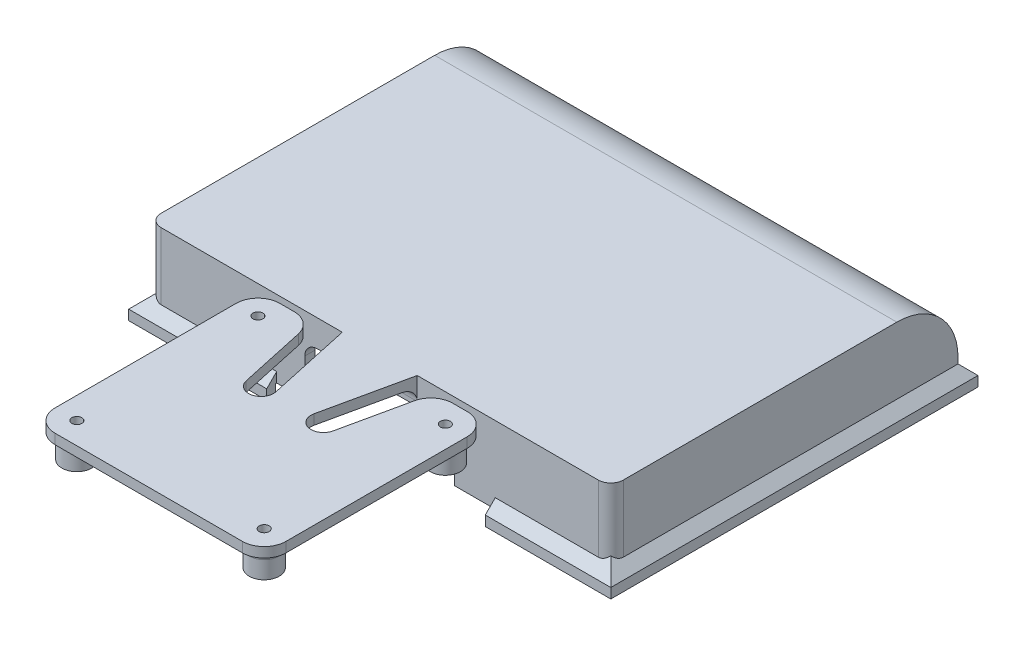
from build123d import *

# Parameters (mm, degrees)
BODY_DEPTH                       = 70.053212
BODY_DEPTH_BACK                  = 3.946788
SHELL1_T                         = -1.6
SKETCH7_W                        = 74
SKETCH7_H                        = 1.6
BACK_WALL_DEPTH                  = 12.3
SKETCH8_W                        = 37
SKETCH8_H                        = 1.6
FAN_MOUNT_DEPTH                  = 37
SKETCH12_R                       = 2.4
FAN_BOSS_DEPTH                   = 3.8
FILLET3_R                        = 1
TAP_DRILL_FOR_M2_TAP1_AT_2_COUNT = 2
TAP_DRILL_FOR_M2_TAP1_AT_2_PITCH = 29
TAP_DRILL_FOR_M2_TAP1_AT_3_COUNT = 2
TAP_DRILL_FOR_M2_TAP1_AT_3_PITCH = 41.72529209
TAP_DRILL_FOR_M2_TAP1_AT_4_COUNT = 2
TAP_DRILL_FOR_M2_TAP1_AT_4_PITCH = 30
CUT_EXTRUDE1_DEPTH               = 361.928196612
FILLET4_R                        = 3.5
EDGE_START                       = -2
EDGE_FLANGE_OUTLINE_W            = 77.2
EDGE_FLANGE_OUTLINE_H            = 58.8
EDGE_FLANGE_OUTLINE_W_2          = 74
EDGE_FLANGE_OUTLINE_H_2          = 55.6
EDGE_FLANGE_DEPTH                = 3.6
CHAMFER1_SIZE                    = 2
SKETCH18_W                       = 74.39999908
SKETCH18_H                       = 56
BOX_RECESS_DEPTH                 = 1.6
FAN_OPENING_REACH                = 94.012
SKETCH15_W                       = 24
SKETCH15_H                       = 8
SKETCH19_W                       = 35
SKETCH19_H                       = 3.2
FAN_RELIEF_DEPTH                 = 93.012212353
AIR_CHANNEL_REACH                = 363.293
SKETCH20_W                       = 6
SKETCH20_H                       = 3.2
CLIP_RELIEF_DEPTH                = 1.8
LPATTERN2_COUNT                  = 3
LPATTERN2_PITCH                  = 21.6
FILLET1_R                        = 2
FILLET2_R                        = 2


# Read off the part's stored shape, not the designer's step: edge flange
with BuildPart() as part:
    # Sketch1 → body (new, two sides: drawn at the far end of the back side and taken through both)
    with BuildSketch(Plane(origin=(0, 0, 0), x_dir=(0, 0, -1), z_dir=(1, 0, 0)).offset(-BODY_DEPTH_BACK)):
        with BuildLine():
            Line((-316.902840602, -4.539561402), (-261.302840602, -4.539561402))
            Line((-261.302840602, -4.539561402), (-261.302840602, -2.039561402))
            ThreePointArc((-261.302840602, -2.039561402), (-264.173194146, 4.890085054), (-271.102840602, 7.760438598))
            Line((-271.102840602, 7.760438598), (-316.902840602, 7.760438598))
            Line((-316.902840602, 7.760438598), (-316.902840602, -4.539561402))
        make_face()
    extrude(amount=BODY_DEPTH + BODY_DEPTH_BACK)

    # Shell1
    shell1_openings = [part.faces().sort_by_distance(p)[0] for p in [
        (33.053212, -4.539561402, 289.102840602),
        (33.053212, 1.610438598, 316.902840602),
    ]]
    offset(amount=SHELL1_T, openings=shell1_openings, kind=Kind.INTERSECTION)

    # Sketch7 → back wall (add)
    with BuildSketch(Plane(origin=(0, -4.539561402, 0), x_dir=(1, 0, 0), z_dir=(0, 1, 0))):
        with Locations((33.053212174, -316.102840602)):
            Rectangle(SKETCH7_W, SKETCH7_H)
    extrude(amount=BACK_WALL_DEPTH)

    # Sketch8 → fan mount (add)
    with BuildSketch(Plane(origin=(0, 0, 316.902840602), x_dir=(-1, 0, 0), z_dir=(0, 0, -1))):
        with Locations((-33.053212174, 6.960438598)):
            Rectangle(SKETCH8_W, SKETCH8_H)
    extrude(amount=-FAN_MOUNT_DEPTH)

    # Sketch12 → fan boss (add)
    with BuildSketch(Plane.XZ.offset(-6.160438598)):
        with Locations(Location((18.053212174, 350.402840602, 0), (0, 0, 180))):
            Circle(SKETCH12_R)
        with Locations(Location((18.053212174, 321.402840602, 0), (0, 0, 180))):
            Circle(SKETCH12_R)
        with Locations(Location((48.053212174, 350.402840602, 0), (0, 0, 180))):
            Circle(SKETCH12_R)
        with Locations(Location((48.053212174, 321.402840602, 0), (0, 0, 180))):
            Circle(SKETCH12_R)
    extrude(amount=FAN_BOSS_DEPTH)

    # Fillet3
    fillet3_edges = [part.edges().sort_by_distance(p)[0] for p in [
        (20.453212174, 6.160438598, 350.402840602),
        (20.453212174, 6.160438598, 321.402840602),
        (50.453212174, 6.160438598, 350.402840602),
        (50.453212174, 6.160438598, 321.402840602),
    ]]
    fillet(fillet3_edges, radius=FILLET3_R)

    # Sketch14 → Tap Drill for M2 Tap1 (revolve, cut)
    with BuildSketch(Plane(origin=(18.053212174, 2.360438598, 321.402840602), x_dir=(0, 0, -1), z_dir=(1, 0, 0))):
        Polygon((0, 0), (0, 5.4), (0.8, 5.4), (0.8, 2.59634927), (1.05, 0), align=None)
    tap_drill_for_m2_tap1 = revolve(axis=Axis((18.053212174, -3.989561402, 321.402840602), (0, 1, 0)), mode=Mode.SUBTRACT)

    # Tap Drill for M2 Tap1 at 2: Tap Drill for M2 Tap1 ×2
    with Locations(*[(0, 0, i * TAP_DRILL_FOR_M2_TAP1_AT_2_PITCH) for i in range(1, TAP_DRILL_FOR_M2_TAP1_AT_2_COUNT)]):
        add(tap_drill_for_m2_tap1, mode=Mode.SUBTRACT)

    # Tap Drill for M2 Tap1 at 3: Tap Drill for M2 Tap1 ×2
    with Locations(*[Vector(0.7189883760491119, 0, 0.6950220968474748) * (i * TAP_DRILL_FOR_M2_TAP1_AT_3_PITCH) for i in range(1, TAP_DRILL_FOR_M2_TAP1_AT_3_COUNT)]):
        add(tap_drill_for_m2_tap1, mode=Mode.SUBTRACT)

    # Tap Drill for M2 Tap1 at 4: Tap Drill for M2 Tap1 ×2
    with Locations(*[(i * TAP_DRILL_FOR_M2_TAP1_AT_4_PITCH, 0, 0) for i in range(1, TAP_DRILL_FOR_M2_TAP1_AT_4_COUNT)]):
        add(tap_drill_for_m2_tap1, mode=Mode.SUBTRACT)

    # Sketch21 → Cut-Extrude1 (cut, through all)
    with BuildSketch(Plane.XZ.offset(-6.160438598)):
        with BuildLine():
            Line((51.553212174, 317.902840602), (51.553212174, 316.902840602))
            Line((51.553212174, 316.902840602), (39.053212174, 316.902840602))
            Line((39.053212174, 316.902840602), (36.098956176, 330.477536602))
            ThreePointArc((36.098956176, 330.477536602), (37.627908175, 332.8570966), (40.007468173, 331.328144602))
            Line((40.007468173, 331.328144602), (42.929212046, 317.902840602))
            Line((42.929212046, 317.902840602), (51.553212174, 317.902840602))
        make_face()
        with BuildLine():
            Line((27.053212174, 316.902840602), (30.007468173, 330.477536602))
            ThreePointArc((30.007468173, 330.477536602), (28.478516174, 332.8570966), (26.098956176, 331.328144602))
            Line((26.098956176, 331.328144602), (23.177212302, 317.902840602))
            Line((23.177212302, 317.902840602), (14.553212174, 317.902840602))
            Line((14.553212174, 317.902840602), (14.553212174, 316.902840602))
            Line((14.553212174, 316.902840602), (27.053212174, 316.902840602))
        make_face()
    extrude(amount=-CUT_EXTRUDE1_DEPTH, mode=Mode.SUBTRACT)

    # Fillet4
    fillet4_edges = [part.edges().sort_by_distance(p)[0] for p in [
        (42.929212046, 6.960438598, 317.902840602),
        (51.553212174, 6.960438598, 317.902840602),
        (14.553212174, 6.960438598, 317.902840602),
        (23.177212302, 6.960438598, 317.902840602),
        (14.553212174, 6.960438598, 353.902840602),
        (51.553212174, 6.960438598, 353.902840602),
    ]]
    fillet(fillet4_edges, radius=FILLET4_R)

    # edge flange outline → edge flange (add)
    with BuildSketch(Plane.XZ.offset(4.539561402).offset(EDGE_START)):
        with Locations((33.053212174, 289.102840602)):
            Rectangle(EDGE_FLANGE_OUTLINE_W, EDGE_FLANGE_OUTLINE_H)
        with Locations((33.053212174, 289.102840602)):
            Rectangle(EDGE_FLANGE_OUTLINE_W_2, EDGE_FLANGE_OUTLINE_H_2, mode=Mode.SUBTRACT)
    extrude(amount=EDGE_FLANGE_DEPTH)

    # Chamfer1
    # the kernel refuses this chamfer: 2 mm, written as the material it takes off along each edge
    with BuildSketch(Plane(origin=(76.79657815, -2.539561402, 318.502840602), x_dir=(0, 0.027495876610586605, -0.9996219169112968), z_dir=(-1, 0, 0))) as chamfer1_piece_1_section:
        Polygon((CHAMFER1_SIZE * 0.999621916911, CHAMFER1_SIZE * 0.0274958766106), (-CHAMFER1_SIZE * 0.0274958766106, CHAMFER1_SIZE * 0.999621916911), (0, 0), align=None)
    chamfer1_piece_1 = extrude(amount=87.486731952, mode=Mode.PRIVATE)
    chamfer1_piece_1 = split(chamfer1_piece_1, bisect_by=Plane(origin=(73.424895075, -2.62002514, 316.902840602), z_dir=(0, 0, -1)), keep=Keep.TOP, mode=Mode.PRIVATE)
    chamfer1_piece_1 = split(chamfer1_piece_1, bisect_by=Plane(origin=(70.053212, -2.62002514, 316.738821544), z_dir=(1, 0, 0)), keep=Keep.TOP, mode=Mode.PRIVATE)
    add(chamfer1_piece_1, mode=Mode.SUBTRACT)
    with BuildSketch(Plane(origin=(76.79657815, -2.539561402, 318.502840602), x_dir=(0, 0.027495876610586605, -0.9996219169112968), z_dir=(-1, 0, 0))) as chamfer1_piece_2_section:
        Polygon((CHAMFER1_SIZE * 0.999621916911, CHAMFER1_SIZE * 0.0274958766106), (-CHAMFER1_SIZE * 0.0274958766106, CHAMFER1_SIZE * 0.999621916911), (0, 0), align=None)
    chamfer1_piece_2 = extrude(amount=87.486731952, mode=Mode.PRIVATE)
    chamfer1_piece_2 = split(chamfer1_piece_2, bisect_by=Plane(origin=(73.424895075, -3.230998227, 316.902840602), z_dir=(0, 0, 1)), keep=Keep.TOP, mode=Mode.PRIVATE)
    chamfer1_piece_2 = split(chamfer1_piece_2, bisect_by=Plane(origin=(70.053212, -3.230998227, 317.903992859), z_dir=(1, 0, 0)), keep=Keep.TOP, mode=Mode.PRIVATE)
    add(chamfer1_piece_2, mode=Mode.SUBTRACT)
    with BuildSketch(Plane(origin=(76.79657815, -2.539561402, 318.502840602), x_dir=(0, 0.027495876610586605, -0.9996219169112968), z_dir=(-1, 0, 0))) as chamfer1_piece_3_section:
        Polygon((CHAMFER1_SIZE * 0.999621916911, CHAMFER1_SIZE * 0.0274958766106), (-CHAMFER1_SIZE * 0.0274958766106, CHAMFER1_SIZE * 0.999621916911), (0, 0), align=None)
    chamfer1_piece_3 = extrude(amount=87.486731952, mode=Mode.PRIVATE)
    chamfer1_piece_3 = split(chamfer1_piece_3, bisect_by=Plane(origin=(33.053212, -3.230998227, 316.902840602), z_dir=(0, 0, 1)), keep=Keep.TOP, mode=Mode.PRIVATE)
    chamfer1_piece_3 = split(chamfer1_piece_3, bisect_by=Plane(origin=(70.053212, -3.230998227, 317.903992859), z_dir=(-1, 0, 0)), keep=Keep.TOP, mode=Mode.PRIVATE)
    chamfer1_piece_3 = split(chamfer1_piece_3, bisect_by=Plane(origin=(-3.946788, -3.230998227, 317.903992859), z_dir=(1, 0, 0)), keep=Keep.TOP, mode=Mode.PRIVATE)
    add(chamfer1_piece_3, mode=Mode.SUBTRACT)
    with BuildSketch(Plane(origin=(76.79657815, -2.539561402, 318.502840602), x_dir=(0, 0.027495876610586605, -0.9996219169112968), z_dir=(-1, 0, 0))) as chamfer1_piece_4_section:
        Polygon((CHAMFER1_SIZE * 0.999621916911, CHAMFER1_SIZE * 0.0274958766106), (-CHAMFER1_SIZE * 0.0274958766106, CHAMFER1_SIZE * 0.999621916911), (0, 0), align=None)
    chamfer1_piece_4 = extrude(amount=87.486731952, mode=Mode.PRIVATE)
    chamfer1_piece_4 = split(chamfer1_piece_4, bisect_by=Plane(origin=(-7.318470901, -2.62002514, 316.902840602), z_dir=(0, 0, -1)), keep=Keep.TOP, mode=Mode.PRIVATE)
    chamfer1_piece_4 = split(chamfer1_piece_4, bisect_by=Plane(origin=(-3.946788, -2.62002514, 316.738821544), z_dir=(-1, 0, 0)), keep=Keep.TOP, mode=Mode.PRIVATE)
    add(chamfer1_piece_4, mode=Mode.SUBTRACT)
    with BuildSketch(Plane(origin=(76.79657815, -2.539561402, 318.502840602), x_dir=(0, 0.027495876610586605, -0.9996219169112968), z_dir=(-1, 0, 0))) as chamfer1_piece_5_section:
        Polygon((CHAMFER1_SIZE * 0.999621916911, CHAMFER1_SIZE * 0.0274958766106), (-CHAMFER1_SIZE * 0.0274958766106, CHAMFER1_SIZE * 0.999621916911), (0, 0), align=None)
    chamfer1_piece_5 = extrude(amount=87.486731952, mode=Mode.PRIVATE)
    chamfer1_piece_5 = split(chamfer1_piece_5, bisect_by=Plane(origin=(-7.318470901, -3.230998227, 316.902840602), z_dir=(0, 0, 1)), keep=Keep.TOP, mode=Mode.PRIVATE)
    chamfer1_piece_5 = split(chamfer1_piece_5, bisect_by=Plane(origin=(-3.946788, -3.230998227, 317.903992859), z_dir=(-1, 0, 0)), keep=Keep.TOP, mode=Mode.PRIVATE)
    add(chamfer1_piece_5, mode=Mode.SUBTRACT)
    with BuildSketch(Plane(origin=(71.653212174, -2.539561402, 254.559474626), x_dir=(-0.9996219169112968, 0.0274958766105862, 0), z_dir=(0, 0, 1))) as chamfer1_piece_6_section:
        Polygon((CHAMFER1_SIZE * 0.999621916911, CHAMFER1_SIZE * 0.0274958766106), (-CHAMFER1_SIZE * 0.0274958766106, CHAMFER1_SIZE * 0.999621916911), (0, 0), align=None)
    chamfer1_piece_6 = extrude(amount=69.086731952, mode=Mode.PRIVATE)
    chamfer1_piece_6 = split(chamfer1_piece_6, bisect_by=Plane(origin=(70.053212, -2.620025079, 257.931157614), z_dir=(-1, 0, 0)), keep=Keep.TOP, mode=Mode.PRIVATE)
    chamfer1_piece_6 = split(chamfer1_piece_6, bisect_by=Plane(origin=(69.889193001, -2.620025079, 261.302840602), z_dir=(0, 0, -1)), keep=Keep.TOP, mode=Mode.PRIVATE)
    add(chamfer1_piece_6, mode=Mode.SUBTRACT)
    with BuildSketch(Plane(origin=(71.653212174, -2.539561402, 254.559474626), x_dir=(-0.9996219169112968, 0.0274958766105862, 0), z_dir=(0, 0, 1))) as chamfer1_piece_7_section:
        Polygon((CHAMFER1_SIZE * 0.999621916911, CHAMFER1_SIZE * 0.0274958766106), (-CHAMFER1_SIZE * 0.0274958766106, CHAMFER1_SIZE * 0.999621916911), (0, 0), align=None)
    chamfer1_piece_7 = extrude(amount=69.086731952, mode=Mode.PRIVATE)
    chamfer1_piece_7 = split(chamfer1_piece_7, bisect_by=Plane(origin=(70.053212, -3.230998206, 257.931157614), z_dir=(1, 0, 0)), keep=Keep.TOP, mode=Mode.PRIVATE)
    chamfer1_piece_7 = split(chamfer1_piece_7, bisect_by=Plane(origin=(71.054364393, -3.230998206, 261.302840602), z_dir=(0, 0, -1)), keep=Keep.TOP, mode=Mode.PRIVATE)
    add(chamfer1_piece_7, mode=Mode.SUBTRACT)
    with BuildSketch(Plane(origin=(71.653212174, -2.539561402, 254.559474626), x_dir=(-0.9996219169112968, 0.0274958766105862, 0), z_dir=(0, 0, 1))) as chamfer1_piece_8_section:
        Polygon((CHAMFER1_SIZE * 0.999621916911, CHAMFER1_SIZE * 0.0274958766106), (-CHAMFER1_SIZE * 0.0274958766106, CHAMFER1_SIZE * 0.999621916911), (0, 0), align=None)
    chamfer1_piece_8 = extrude(amount=69.086731952, mode=Mode.PRIVATE)
    chamfer1_piece_8 = split(chamfer1_piece_8, bisect_by=Plane(origin=(71.054364393, -3.230998206, 316.902840602), z_dir=(0, 0, -1)), keep=Keep.TOP, mode=Mode.PRIVATE)
    chamfer1_piece_8 = split(chamfer1_piece_8, bisect_by=Plane(origin=(70.053212, -3.230998206, 289.102840602), z_dir=(1, 0, 0)), keep=Keep.TOP, mode=Mode.PRIVATE)
    chamfer1_piece_8 = split(chamfer1_piece_8, bisect_by=Plane(origin=(71.054364393, -3.230998206, 261.302840602), z_dir=(0, 0, 1)), keep=Keep.TOP, mode=Mode.PRIVATE)
    add(chamfer1_piece_8, mode=Mode.SUBTRACT)
    with BuildSketch(Plane(origin=(71.653212174, -2.539561402, 254.559474626), x_dir=(-0.9996219169112968, 0.0274958766105862, 0), z_dir=(0, 0, 1))) as chamfer1_piece_9_section:
        Polygon((CHAMFER1_SIZE * 0.999621916911, CHAMFER1_SIZE * 0.0274958766106), (-CHAMFER1_SIZE * 0.0274958766106, CHAMFER1_SIZE * 0.999621916911), (0, 0), align=None)
    chamfer1_piece_9 = extrude(amount=69.086731952, mode=Mode.PRIVATE)
    chamfer1_piece_9 = split(chamfer1_piece_9, bisect_by=Plane(origin=(69.889193001, -2.620025079, 316.902840602), z_dir=(0, 0, 1)), keep=Keep.TOP, mode=Mode.PRIVATE)
    chamfer1_piece_9 = split(chamfer1_piece_9, bisect_by=Plane(origin=(70.053212, -2.620025079, 320.27452359), z_dir=(-1, 0, 0)), keep=Keep.TOP, mode=Mode.PRIVATE)
    add(chamfer1_piece_9, mode=Mode.SUBTRACT)
    with BuildSketch(Plane(origin=(71.653212174, -2.539561402, 254.559474626), x_dir=(-0.9996219169112968, 0.0274958766105862, 0), z_dir=(0, 0, 1))) as chamfer1_piece_10_section:
        Polygon((CHAMFER1_SIZE * 0.999621916911, CHAMFER1_SIZE * 0.0274958766106), (-CHAMFER1_SIZE * 0.0274958766106, CHAMFER1_SIZE * 0.999621916911), (0, 0), align=None)
    chamfer1_piece_10 = extrude(amount=69.086731952, mode=Mode.PRIVATE)
    chamfer1_piece_10 = split(chamfer1_piece_10, bisect_by=Plane(origin=(71.054364393, -3.230998206, 316.902840602), z_dir=(0, 0, 1)), keep=Keep.TOP, mode=Mode.PRIVATE)
    chamfer1_piece_10 = split(chamfer1_piece_10, bisect_by=Plane(origin=(70.053212, -3.230998206, 320.27452359), z_dir=(1, 0, 0)), keep=Keep.TOP, mode=Mode.PRIVATE)
    add(chamfer1_piece_10, mode=Mode.SUBTRACT)
    with BuildSketch(Plane(origin=(-10.690153802, -2.539561402, 259.702840602), x_dir=(0, 0.027495876610586174, 0.9996219169112968), z_dir=(1, 0, 0))) as chamfer1_piece_11_section:
        Polygon((CHAMFER1_SIZE * 0.999621916911, CHAMFER1_SIZE * 0.0274958766106), (-CHAMFER1_SIZE * 0.0274958766106, CHAMFER1_SIZE * 0.999621916911), (0, 0), align=None)
    chamfer1_piece_11 = extrude(amount=87.486731952, mode=Mode.PRIVATE)
    chamfer1_piece_11 = split(chamfer1_piece_11, bisect_by=Plane(origin=(-3.946788, -2.620025141, 261.46685966), z_dir=(-1, 0, 0)), keep=Keep.TOP, mode=Mode.PRIVATE)
    chamfer1_piece_11 = split(chamfer1_piece_11, bisect_by=Plane(origin=(-7.318470901, -2.620025141, 261.302840602), z_dir=(0, 0, 1)), keep=Keep.TOP, mode=Mode.PRIVATE)
    add(chamfer1_piece_11, mode=Mode.SUBTRACT)
    with BuildSketch(Plane(origin=(-10.690153802, -2.539561402, 259.702840602), x_dir=(0, 0.027495876610586174, 0.9996219169112968), z_dir=(1, 0, 0))) as chamfer1_piece_12_section:
        Polygon((CHAMFER1_SIZE * 0.999621916911, CHAMFER1_SIZE * 0.0274958766106), (-CHAMFER1_SIZE * 0.0274958766106, CHAMFER1_SIZE * 0.999621916911), (0, 0), align=None)
    chamfer1_piece_12 = extrude(amount=87.486731952, mode=Mode.PRIVATE)
    chamfer1_piece_12 = split(chamfer1_piece_12, bisect_by=Plane(origin=(-3.946788, -3.230998227, 260.301688344), z_dir=(-1, 0, 0)), keep=Keep.TOP, mode=Mode.PRIVATE)
    chamfer1_piece_12 = split(chamfer1_piece_12, bisect_by=Plane(origin=(-7.318470901, -3.230998227, 261.302840602), z_dir=(0, 0, -1)), keep=Keep.TOP, mode=Mode.PRIVATE)
    add(chamfer1_piece_12, mode=Mode.SUBTRACT)
    with BuildSketch(Plane(origin=(-10.690153802, -2.539561402, 259.702840602), x_dir=(0, 0.027495876610586174, 0.9996219169112968), z_dir=(1, 0, 0))) as chamfer1_piece_13_section:
        Polygon((CHAMFER1_SIZE * 0.999621916911, CHAMFER1_SIZE * 0.0274958766106), (-CHAMFER1_SIZE * 0.0274958766106, CHAMFER1_SIZE * 0.999621916911), (0, 0), align=None)
    chamfer1_piece_13 = extrude(amount=87.486731952, mode=Mode.PRIVATE)
    chamfer1_piece_13 = split(chamfer1_piece_13, bisect_by=Plane(origin=(70.053212, -3.230998227, 260.301688344), z_dir=(-1, 0, 0)), keep=Keep.TOP, mode=Mode.PRIVATE)
    chamfer1_piece_13 = split(chamfer1_piece_13, bisect_by=Plane(origin=(-3.946788, -3.230998227, 260.301688344), z_dir=(1, 0, 0)), keep=Keep.TOP, mode=Mode.PRIVATE)
    chamfer1_piece_13 = split(chamfer1_piece_13, bisect_by=Plane(origin=(33.053212, -3.230998227, 261.302840602), z_dir=(0, 0, -1)), keep=Keep.TOP, mode=Mode.PRIVATE)
    add(chamfer1_piece_13, mode=Mode.SUBTRACT)
    with BuildSketch(Plane(origin=(-10.690153802, -2.539561402, 259.702840602), x_dir=(0, 0.027495876610586174, 0.9996219169112968), z_dir=(1, 0, 0))) as chamfer1_piece_14_section:
        Polygon((CHAMFER1_SIZE * 0.999621916911, CHAMFER1_SIZE * 0.0274958766106), (-CHAMFER1_SIZE * 0.0274958766106, CHAMFER1_SIZE * 0.999621916911), (0, 0), align=None)
    chamfer1_piece_14 = extrude(amount=87.486731952, mode=Mode.PRIVATE)
    chamfer1_piece_14 = split(chamfer1_piece_14, bisect_by=Plane(origin=(70.053212, -2.620025141, 261.46685966), z_dir=(1, 0, 0)), keep=Keep.TOP, mode=Mode.PRIVATE)
    chamfer1_piece_14 = split(chamfer1_piece_14, bisect_by=Plane(origin=(73.424895075, -2.620025141, 261.302840602), z_dir=(0, 0, 1)), keep=Keep.TOP, mode=Mode.PRIVATE)
    add(chamfer1_piece_14, mode=Mode.SUBTRACT)
    with BuildSketch(Plane(origin=(-10.690153802, -2.539561402, 259.702840602), x_dir=(0, 0.027495876610586174, 0.9996219169112968), z_dir=(1, 0, 0))) as chamfer1_piece_15_section:
        Polygon((CHAMFER1_SIZE * 0.999621916911, CHAMFER1_SIZE * 0.0274958766106), (-CHAMFER1_SIZE * 0.0274958766106, CHAMFER1_SIZE * 0.999621916911), (0, 0), align=None)
    chamfer1_piece_15 = extrude(amount=87.486731952, mode=Mode.PRIVATE)
    chamfer1_piece_15 = split(chamfer1_piece_15, bisect_by=Plane(origin=(70.053212, -3.230998227, 260.301688344), z_dir=(1, 0, 0)), keep=Keep.TOP, mode=Mode.PRIVATE)
    chamfer1_piece_15 = split(chamfer1_piece_15, bisect_by=Plane(origin=(73.424895075, -3.230998227, 261.302840602), z_dir=(0, 0, -1)), keep=Keep.TOP, mode=Mode.PRIVATE)
    add(chamfer1_piece_15, mode=Mode.SUBTRACT)
    with BuildSketch(Plane(origin=(-5.546787826, -2.539561402, 323.646206578), x_dir=(0.9996219169112968, 0.027495876610586275, 0), z_dir=(0, 0, -1))) as chamfer1_piece_16_section:
        Polygon((CHAMFER1_SIZE * 0.999621916911, CHAMFER1_SIZE * 0.0274958766106), (-CHAMFER1_SIZE * 0.0274958766106, CHAMFER1_SIZE * 0.999621916911), (0, 0), align=None)
    chamfer1_piece_16 = extrude(amount=69.086731952, mode=Mode.PRIVATE)
    chamfer1_piece_16 = split(chamfer1_piece_16, bisect_by=Plane(origin=(-3.782768884, -2.620025202, 316.902840602), z_dir=(0, 0, 1)), keep=Keep.TOP, mode=Mode.PRIVATE)
    chamfer1_piece_16 = split(chamfer1_piece_16, bisect_by=Plane(origin=(-3.946788, -2.620025202, 320.27452359), z_dir=(1, 0, 0)), keep=Keep.TOP, mode=Mode.PRIVATE)
    add(chamfer1_piece_16, mode=Mode.SUBTRACT)
    with BuildSketch(Plane(origin=(-5.546787826, -2.539561402, 323.646206578), x_dir=(0.9996219169112968, 0.027495876610586275, 0), z_dir=(0, 0, -1))) as chamfer1_piece_17_section:
        Polygon((CHAMFER1_SIZE * 0.999621916911, CHAMFER1_SIZE * 0.0274958766106), (-CHAMFER1_SIZE * 0.0274958766106, CHAMFER1_SIZE * 0.999621916911), (0, 0), align=None)
    chamfer1_piece_17 = extrude(amount=69.086731952, mode=Mode.PRIVATE)
    chamfer1_piece_17 = split(chamfer1_piece_17, bisect_by=Plane(origin=(-4.947940122, -3.230998247, 316.902840602), z_dir=(0, 0, 1)), keep=Keep.TOP, mode=Mode.PRIVATE)
    chamfer1_piece_17 = split(chamfer1_piece_17, bisect_by=Plane(origin=(-3.946788, -3.230998247, 320.27452359), z_dir=(-1, 0, 0)), keep=Keep.TOP, mode=Mode.PRIVATE)
    add(chamfer1_piece_17, mode=Mode.SUBTRACT)
    with BuildSketch(Plane(origin=(-5.546787826, -2.539561402, 323.646206578), x_dir=(0.9996219169112968, 0.027495876610586275, 0), z_dir=(0, 0, -1))) as chamfer1_piece_18_section:
        Polygon((CHAMFER1_SIZE * 0.999621916911, CHAMFER1_SIZE * 0.0274958766106), (-CHAMFER1_SIZE * 0.0274958766106, CHAMFER1_SIZE * 0.999621916911), (0, 0), align=None)
    chamfer1_piece_18 = extrude(amount=69.086731952, mode=Mode.PRIVATE)
    chamfer1_piece_18 = split(chamfer1_piece_18, bisect_by=Plane(origin=(-4.947940122, -3.230998247, 316.902840602), z_dir=(0, 0, -1)), keep=Keep.TOP, mode=Mode.PRIVATE)
    chamfer1_piece_18 = split(chamfer1_piece_18, bisect_by=Plane(origin=(-3.946788, -3.230998247, 289.102840602), z_dir=(-1, 0, 0)), keep=Keep.TOP, mode=Mode.PRIVATE)
    chamfer1_piece_18 = split(chamfer1_piece_18, bisect_by=Plane(origin=(-4.947940122, -3.230998247, 261.302840602), z_dir=(0, 0, 1)), keep=Keep.TOP, mode=Mode.PRIVATE)
    add(chamfer1_piece_18, mode=Mode.SUBTRACT)
    with BuildSketch(Plane(origin=(-5.546787826, -2.539561402, 323.646206578), x_dir=(0.9996219169112968, 0.027495876610586275, 0), z_dir=(0, 0, -1))) as chamfer1_piece_19_section:
        Polygon((CHAMFER1_SIZE * 0.999621916911, CHAMFER1_SIZE * 0.0274958766106), (-CHAMFER1_SIZE * 0.0274958766106, CHAMFER1_SIZE * 0.999621916911), (0, 0), align=None)
    chamfer1_piece_19 = extrude(amount=69.086731952, mode=Mode.PRIVATE)
    chamfer1_piece_19 = split(chamfer1_piece_19, bisect_by=Plane(origin=(-3.946788, -2.620025202, 257.931157614), z_dir=(1, 0, 0)), keep=Keep.TOP, mode=Mode.PRIVATE)
    chamfer1_piece_19 = split(chamfer1_piece_19, bisect_by=Plane(origin=(-3.782768884, -2.620025202, 261.302840602), z_dir=(0, 0, -1)), keep=Keep.TOP, mode=Mode.PRIVATE)
    add(chamfer1_piece_19, mode=Mode.SUBTRACT)
    with BuildSketch(Plane(origin=(-5.546787826, -2.539561402, 323.646206578), x_dir=(0.9996219169112968, 0.027495876610586275, 0), z_dir=(0, 0, -1))) as chamfer1_piece_20_section:
        Polygon((CHAMFER1_SIZE * 0.999621916911, CHAMFER1_SIZE * 0.0274958766106), (-CHAMFER1_SIZE * 0.0274958766106, CHAMFER1_SIZE * 0.999621916911), (0, 0), align=None)
    chamfer1_piece_20 = extrude(amount=69.086731952, mode=Mode.PRIVATE)
    chamfer1_piece_20 = split(chamfer1_piece_20, bisect_by=Plane(origin=(-3.946788, -3.230998247, 257.931157614), z_dir=(-1, 0, 0)), keep=Keep.TOP, mode=Mode.PRIVATE)
    chamfer1_piece_20 = split(chamfer1_piece_20, bisect_by=Plane(origin=(-4.947940122, -3.230998247, 261.302840602), z_dir=(0, 0, -1)), keep=Keep.TOP, mode=Mode.PRIVATE)
    add(chamfer1_piece_20, mode=Mode.SUBTRACT)

    # Sketch18 → box recess (cut)
    with BuildSketch(Plane(origin=(0, -6.139561402, 0), x_dir=(-1, 0, 0), z_dir=(0, -1, 0))):
        with Locations((-33.053212726, -289.102840602)):
            Rectangle(SKETCH18_W, SKETCH18_H)
    extrude(amount=-BOX_RECESS_DEPTH, mode=Mode.SUBTRACT)

    # Sketch15 → fan opening (cut, up to next)
    with BuildSketch(Plane.XY.offset(316.902840602), mode=Mode.PRIVATE) as fan_opening_sk1:
        with Locations((33.053212174, -0.539561402)):
            Rectangle(SKETCH15_W, SKETCH15_H)
    fan_opening_tool1 = extrude(fan_opening_sk1.sketch, amount=-FAN_OPENING_REACH, mode=Mode.PRIVATE) & part.part
    add(fan_opening_tool1.solids().sort_by_distance((33.053212, -0.539561, 316.902841))[0], mode=Mode.SUBTRACT)

    # Sketch19 → fan relief (cut, through all)
    with BuildSketch(Plane.XY.offset(316.902840602)):
        with Locations((34.053212174, -4.539561402)):
            Rectangle(SKETCH19_W, SKETCH19_H)
    extrude(amount=FAN_RELIEF_DEPTH, mode=Mode.SUBTRACT)

    # Sketch16 → air channel (add, up to next)
    with BuildSketch(Plane.XZ.offset(4.539561402), mode=Mode.PRIVATE) as air_channel_sk1:
        with BuildLine():
            Line((62.453212174, 261.102840602), (62.453212174, 291.102840602))
            ThreePointArc((62.453212174, 291.102840602), (54.653212174, 298.902840602), (46.853212174, 291.102840602))
            Line((46.853212174, 291.102840602), (46.853212174, 261.102840602))
            Line((46.853212174, 261.102840602), (62.453212174, 261.102840602))
        make_face()
        with BuildLine():
            Line((48.453212174, 262.702840602), (60.853212174, 262.702840602))
            Line((60.853212174, 262.702840602), (60.853212174, 291.102840602))
            ThreePointArc((60.853212174, 291.102840602), (54.653212174, 297.302840602), (48.453212174, 291.102840602))
            Line((48.453212174, 291.102840602), (48.453212174, 262.702840602))
        make_face(mode=Mode.SUBTRACT)
    air_channel_tool1 = extrude(air_channel_sk1.sketch, amount=-AIR_CHANNEL_REACH, mode=Mode.PRIVATE) - part.part
    air_channel = air_channel_tool1.solids().sort_by_distance((47.262138, -4.539561, 276.102841))[0]
    add(air_channel)

    # Sketch20 → clip relief (cut)
    with BuildSketch(Plane.XZ.offset(6.139561402)):
        with Locations((52.753212174, 261.302840602)):
            Rectangle(SKETCH20_W, SKETCH20_H)
    clip_relief = extrude(amount=-CLIP_RELIEF_DEPTH, mode=Mode.SUBTRACT)

    # LPattern2: air channel, clip relief ×3
    with Locations(*[(-i * LPATTERN2_PITCH, 0, 0) for i in range(1, LPATTERN2_COUNT)]):
        add(air_channel)
        add(clip_relief, mode=Mode.SUBTRACT)

    # Fillet1
    fillet1_edges = [part.edges().sort_by_distance(p)[0] for p in [
        (-3.946787956, 2.410438555, 316.902840602),
        (70.053212044, 2.410438642, 316.902840602),
        (45.053212174, 3.460438598, 316.102840602),
        (21.053212174, 3.460438598, 316.102840602),
        (46.853212174, -3.289561402, 262.902840602),
        (46.853212174, 3.758714204, 265.304564996),
        (46.853212174, 6.160438598, 281.102840602),
        (54.653212174, 6.160438598, 298.902840602),
        (62.453212174, 6.160438598, 281.102840602),
        (62.453212174, -3.289561402, 262.902840602),
        (62.453212174, 3.758714204, 265.304564996),
        (68.453212, 3.758714204, 265.304564996),
        (68.453212, -3.289561402, 262.902840602),
        (25.253212174, -3.289561402, 262.902840602),
        (25.253212174, 3.758714204, 265.304564996),
        (25.253212174, 6.160438598, 281.102840602),
        (33.053212174, 6.160438598, 298.902840602),
        (40.853212174, 6.160438598, 281.102840602),
        (40.853212174, -3.289561402, 262.902840602),
        (40.853212174, 3.758714204, 265.304564996),
        (-2.346788, 3.758714204, 265.304564996),
        (-2.346788, -3.289561402, 262.902840602),
        (3.653212174, -3.289561402, 262.902840602),
        (3.653212174, 3.758714204, 265.304564996),
        (3.653212174, 6.160438598, 281.102840602),
        (11.453212174, 6.160438598, 298.902840602),
        (19.253212174, 6.160438598, 281.102840602),
        (19.253212174, -3.289561402, 262.902840602),
        (19.253212174, 3.758714204, 265.304564996),
        (-2.346788, 6.160438598, 293.202840602),
        (68.453212, 6.160438598, 293.202840602),
        (33.053212, 6.160438598, 315.302840602),
    ]]
    fillet(fillet1_edges, radius=FILLET1_R)

    # Fillet2
    # the kernel refuses this fillet: 2 mm, written as the material it adds along each edge
    with BuildSketch(Plane(origin=(66.453212, 4.160438598, 313.302840602), x_dir=(0, 0, 1), z_dir=(1, 0, 0))) as fillet2_piece_1_section:
        Polygon((0, 0), (FILLET2_R * 1.02, 0), (FILLET2_R * 1.02, -FILLET2_R * 1.02), (0, -FILLET2_R * 1.02), align=None)
    fillet2_piece_1 = extrude(amount=FILLET2_R * 1.02, mode=Mode.PRIVATE)
    fillet2_piece_1 = fillet2_piece_1 - Plane(origin=(66.453212, 4.160438598, 313.302840602), x_dir=(0, -0.7071067811865475, -0.7071067811865475), z_dir=(1, 0, 0)) * Sphere(FILLET2_R, mode=Mode.PRIVATE)
    add(fillet2_piece_1)
    with BuildSketch(Plane(origin=(-0.346788, 4.160438598, 313.302840602), x_dir=(-1, 0, 0), z_dir=(0, 0, 1))) as fillet2_piece_2_section:
        Polygon((0, 0), (FILLET2_R * 1.02, 0), (FILLET2_R * 1.02, -FILLET2_R * 1.02), (0, -FILLET2_R * 1.02), align=None)
    fillet2_piece_2 = extrude(amount=FILLET2_R * 1.02, mode=Mode.PRIVATE)
    fillet2_piece_2 = fillet2_piece_2 - Plane(origin=(-0.346788, 4.160438598, 313.302840602), x_dir=(0.7071067811865475, -0.7071067811865475, 0), z_dir=(0, 0, 1)) * Sphere(FILLET2_R, mode=Mode.PRIVATE)
    add(fillet2_piece_2)
    with BuildSketch(Plane(origin=(22.053212174, 6.160438598, 316.902840602), x_dir=(0, -1, 0), z_dir=(1, 0, 0))) as fillet2_piece_3_section:
        with BuildLine():
            CenterArc((FILLET2_R, -FILLET2_R), FILLET2_R, 90, 90)
            Line((0, -FILLET2_R), (0, 0))
            Line((0, 0), (FILLET2_R, 0))
        make_face()
    fillet2_piece_3 = extrude(amount=22, mode=Mode.PRIVATE)
    fillet2_piece_3 = split(fillet2_piece_3, bisect_by=Plane(origin=(38.690137877, 5.710652426, 318.571153442), z_dir=(-0.9771279992502401, 0, -0.212651999946445)), keep=Keep.TOP, mode=Mode.PRIVATE)
    fillet2_piece_3 = split(fillet2_piece_3, bisect_by=Plane(origin=(27.416286472, 5.710652426, 318.571153442), z_dir=(0.9771279992502397, 0, -0.2126519999464467)), keep=Keep.TOP, mode=Mode.PRIVATE)
    add(fillet2_piece_3)
    with BuildSketch(Plane(origin=(-2.346788, -4.539561402, 315.302840602), x_dir=(1, 0, 0), z_dir=(0, 1, 0)), Plane(origin=(68.453212, -4.539561402, 315.302840602), x_dir=(0, 0, -1), z_dir=(0, 1, 0))) as fillet2_piece_4:
        with BuildLine():
            CenterArc((FILLET2_R, FILLET2_R), FILLET2_R, 180, 90)
            Line((0, FILLET2_R), (0, 0))
            Line((0, 0), (FILLET2_R, 0))
        make_face()
    extrude(amount=8.7)


solid = part.part
